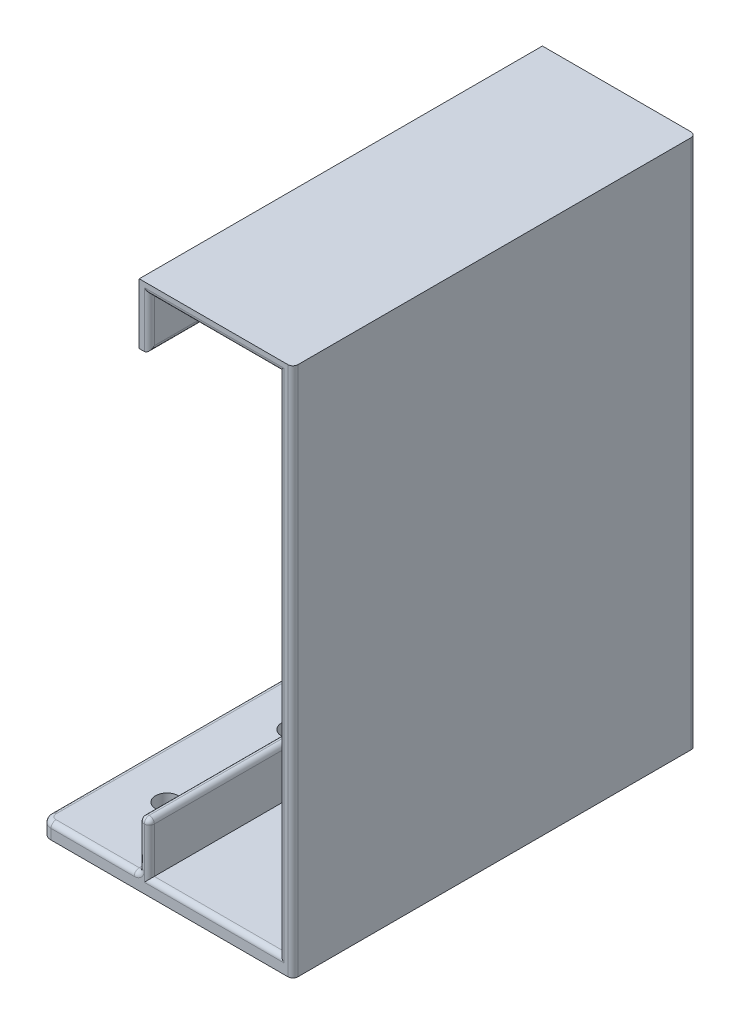
from build123d import *

# Parameters (mm, degrees)
SKETCH1_W           = 50
SKETCH1_H           = 80
BOSS_EXTRUDE1_DEPTH = 3
SKETCH2_R           = 2.25
CUT_EXTRUDE1_DEPTH  = 48.265209192
SKETCH3_W           = 2.8
SKETCH3_H           = 80
SKETCH3_W_2         = 2
BOSS_EXTRUDE2_DEPTH = 10
SKETCH4_W           = 2.8
SKETCH4_H           = 80
BOSS_EXTRUDE3_DEPTH = 90.2
SKETCH5_W           = 30.5
SKETCH5_H           = 80
BOSS_EXTRUDE4_DEPTH = 2
SKETCH6_W           = 2
SKETCH6_H           = 80
BOSS_EXTRUDE5_DEPTH = 10
FILLET1_R           = 1
FILLET2_R           = 2


# Some blends are built 0.0001 mm under size
with BuildPart() as part:
    # Sketch1 → Boss-Extrude1 (new body)
    with BuildSketch(Plane(origin=(0, 0, 0), x_dir=(1, 0, 0), z_dir=(0, 1, 0))):
        Rectangle(SKETCH1_W, SKETCH1_H)
    extrude(amount=BOSS_EXTRUDE1_DEPTH)

    # Sketch2 → Cut-Extrude1 (cut, through all)
    with BuildSketch(Plane(origin=(0, 3, 0), x_dir=(1, 0, 0), z_dir=(0, 1, 0))):
        with Locations(Location((-15, 0, 0), (0, 0, 270))):
            Circle(SKETCH2_R)
        with Locations(Location((-15, 25, 0), (0, 0, 270))):
            Circle(SKETCH2_R)
        with Locations(Location((-15, -25, 0), (0, 0, 270))):
            Circle(SKETCH2_R)
    extrude(amount=-CUT_EXTRUDE1_DEPTH, mode=Mode.SUBTRACT)

    # Sketch3 → Boss-Extrude2 (add)
    with BuildSketch(Plane(origin=(0, 3, 0), x_dir=(1, 0, 0), z_dir=(0, 1, 0))):
        with Locations((23.6, 0)):
            Rectangle(SKETCH3_W, SKETCH3_H)
        with Locations((-4.5, 0)):
            Rectangle(SKETCH3_W_2, SKETCH3_H)
    extrude(amount=BOSS_EXTRUDE2_DEPTH)

    # Sketch4 → Boss-Extrude3 (add)
    with BuildSketch(Plane(origin=(0, 13, 0), x_dir=(1, 0, 0), z_dir=(0, 1, 0))):
        with Locations((23.6, 0)):
            Rectangle(SKETCH4_W, SKETCH4_H)
    extrude(amount=BOSS_EXTRUDE3_DEPTH)

    # Sketch5 → Boss-Extrude4 (add)
    with BuildSketch(Plane(origin=(0, 103.2, 0), x_dir=(1, 0, 0), z_dir=(0, 1, 0))):
        with Locations((9.75, 0)):
            Rectangle(SKETCH5_W, SKETCH5_H)
    extrude(amount=BOSS_EXTRUDE4_DEPTH)

    # Sketch6 → Boss-Extrude5 (add)
    with BuildSketch(Plane.XZ.offset(-103.2)):
        with Locations((-4.5, 0)):
            Rectangle(SKETCH6_W, SKETCH6_H)
    extrude(amount=BOSS_EXTRUDE5_DEPTH)

    # Fillet1
    fillet1_edges = [part.edges().sort_by_distance(p)[0] for p in [
        (-25, 3, 0),
        (-15.25, 3, 40),
        (9.35, 3, -40),
        (22.2, 53.1, 40),
        (22.2, 53.1, -40),
        (-15.25, 3, -40),
        (9.35, 3, 40),
        (-5.5, 8, 40),
        (-3.5, 8, 40),
        (-3.5, 8, -40),
        (-5.5, 3, 0),
        (-5.5, 8, -40),
        (-4.5, 13, 40),
        (-3.5, 13, 0),
        (-5.5, 13, 0),
        (9.35, 103.2, -40),
        (25, 52.6, 40),
        (25, 52.6, -40),
        (9.35, 103.2, 40),
        (-3.5, 98.2, -40),
        (-3.5, 98.2, 40),
        (-3.5, 93.2, 0),
    ]]
    fillet(fillet1_edges, radius=FILLET1_R - 0.0001)  # a hair under: the kernel refuses the full size

    # Fillet2
    # the kernel refuses this fillet: 2 mm, written as the material it takes off along each edge
    with BuildSketch(Plane(origin=(-23, 3, 38), x_dir=(-1, 0, 0), z_dir=(0, 0, -1))) as fillet2_piece_1:
        with BuildLine():
            CenterArc((1.0001, -0.9999), 0.9999, 0, 90)
            Line((2, -0.9999), (2, 0))
            Line((2, 0), (1.0001, 0))
        make_face()
    revolve(axis=Axis((-23, 3, 38), (0, 1, 0)), revolution_arc=90, mode=Mode.SUBTRACT)
    with BuildSketch(Plane(origin=(-23, 3, -38), x_dir=(0, 0, -1), z_dir=(1, 0, 0))) as fillet2_piece_2:
        with BuildLine():
            CenterArc((1.0001, -0.9999), 0.9999, 0, 90)
            Line((2, -0.9999), (2, 0))
            Line((2, 0), (1.0001, 0))
        make_face()
    revolve(axis=Axis((-23, 3, -38), (0, 1, 0)), revolution_arc=90, mode=Mode.SUBTRACT)
    with BuildSketch(Plane(origin=(-25, -5, 40), x_dir=(0, 0, -1), z_dir=(0, 1, 0)), Plane(origin=(-25, -5, -40), x_dir=(1, 0, 0), z_dir=(0, 1, 0))) as fillet2_piece_3:
        with BuildLine():
            CenterArc((FILLET2_R, -FILLET2_R), FILLET2_R, 90, 90)
            Line((0, -FILLET2_R), (0, 0))
            Line((0, 0), (FILLET2_R, 0))
        make_face()
    extrude(amount=8, mode=Mode.SUBTRACT)


solid = part.part
